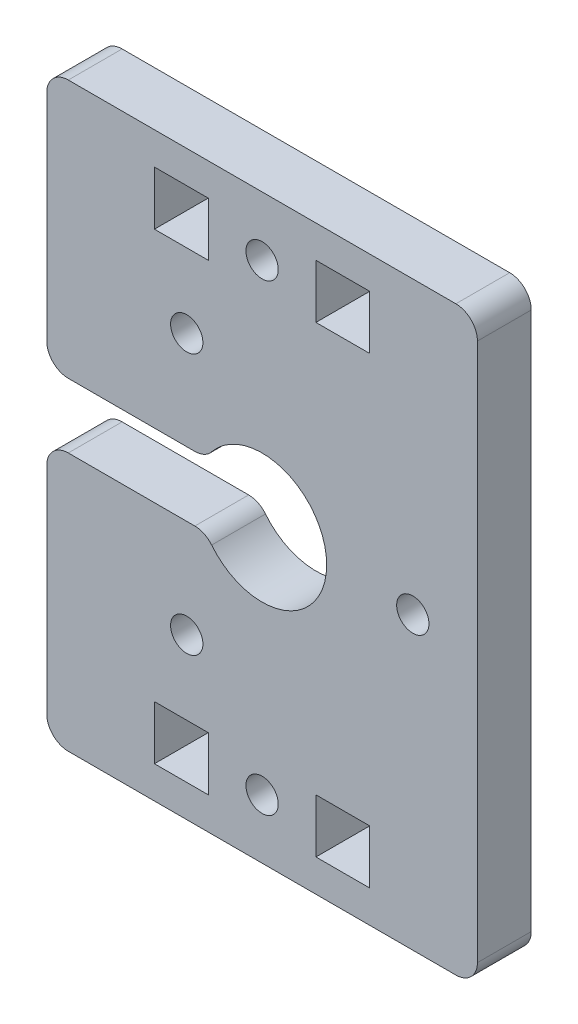
from build123d import *

# Parameters (mm, degrees)
ESQUISSE1_R        = 1.5
ESQUISSE1_W        = 5
ESQUISSE1_H        = 5
BOSS_EXTRU_1_DEPTH = 5
CONG_1_R           = 2


with BuildPart() as part:
    # Esquisse1 → Boss.-Extru.1 (new body)
    with BuildSketch(Plane.XY):
        with BuildLine():
            Line((-20, 27), (20, 27))
            Line((20, 27), (20, -27))
            Line((20, -27), (-20, -27))
            Line((-20, -27), (-20, -3))
            Line((-20, -3), (-5.196152423, -3))
            ThreePointArc((-5.196152423, -3), (6, 0), (-5.196152423, 3))
            Line((-5.196152423, 3), (-20, 3))
            Line((-20, 3), (-20, 27))
        make_face()
        with Locations((14, 0)):
            Circle(ESQUISSE1_R, mode=Mode.SUBTRACT)
        with Locations((-7, -12.124355653)):
            Circle(ESQUISSE1_R, mode=Mode.SUBTRACT)
        with Locations((-7, 12.124355653)):
            Circle(ESQUISSE1_R, mode=Mode.SUBTRACT)
        with Locations((0, 21.5)):
            Circle(ESQUISSE1_R, mode=Mode.SUBTRACT)
        with Locations((0, -21.5)):
            Circle(ESQUISSE1_R, mode=Mode.SUBTRACT)
        with Locations((-7.5, 21.5)):
            Rectangle(ESQUISSE1_W, ESQUISSE1_H, mode=Mode.SUBTRACT)
        with Locations((7.5, 21.5)):
            Rectangle(ESQUISSE1_W, ESQUISSE1_H, mode=Mode.SUBTRACT)
        with Locations((-7.5, -21.5)):
            Rectangle(ESQUISSE1_W, ESQUISSE1_H, mode=Mode.SUBTRACT)
        with Locations((7.5, -21.5)):
            Rectangle(ESQUISSE1_W, ESQUISSE1_H, mode=Mode.SUBTRACT)
    extrude(amount=BOSS_EXTRU_1_DEPTH)

    # Congé1
    cong_1_edges = [part.edges().sort_by_distance(p)[0] for p in [
        (-5.196152423, 3, 2.5),
        (20, -27, 2.5),
        (-20, -27, 2.5),
        (-20, -3, 2.5),
        (-5.196152423, -3, 2.5),
        (-20, 3, 2.5),
        (20, 27, 2.5),
        (-20, 27, 2.5),
    ]]
    fillet(cong_1_edges, radius=CONG_1_R)


solid = part.part
